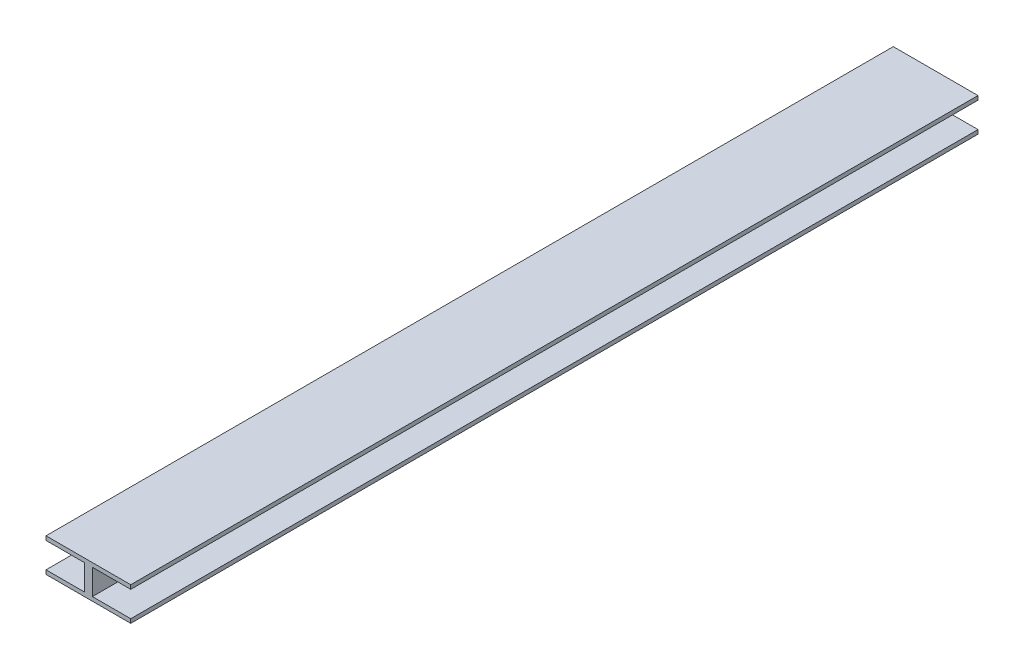
from build123d import *

# Parameters (mm, degrees)
SALIENTE_EXTRUIR1_DEPTH = 500


with BuildPart() as part:
    # Croquis1 → Saliente-Extruir1 (new, symmetric)
    with BuildSketch(Plane.XY):
        Polygon((-4.7625, 15), (-4.7625, -15), (-50, -15), (-50, -19.7625), (50, -19.7625), (50, -15), (4.7625, -15), (4.7625, 15), (50, 15), (50, 19.7625), (-50, 19.7625), (-50, 15), align=None)
    extrude(amount=SALIENTE_EXTRUIR1_DEPTH, both=True)


solid = part.part
